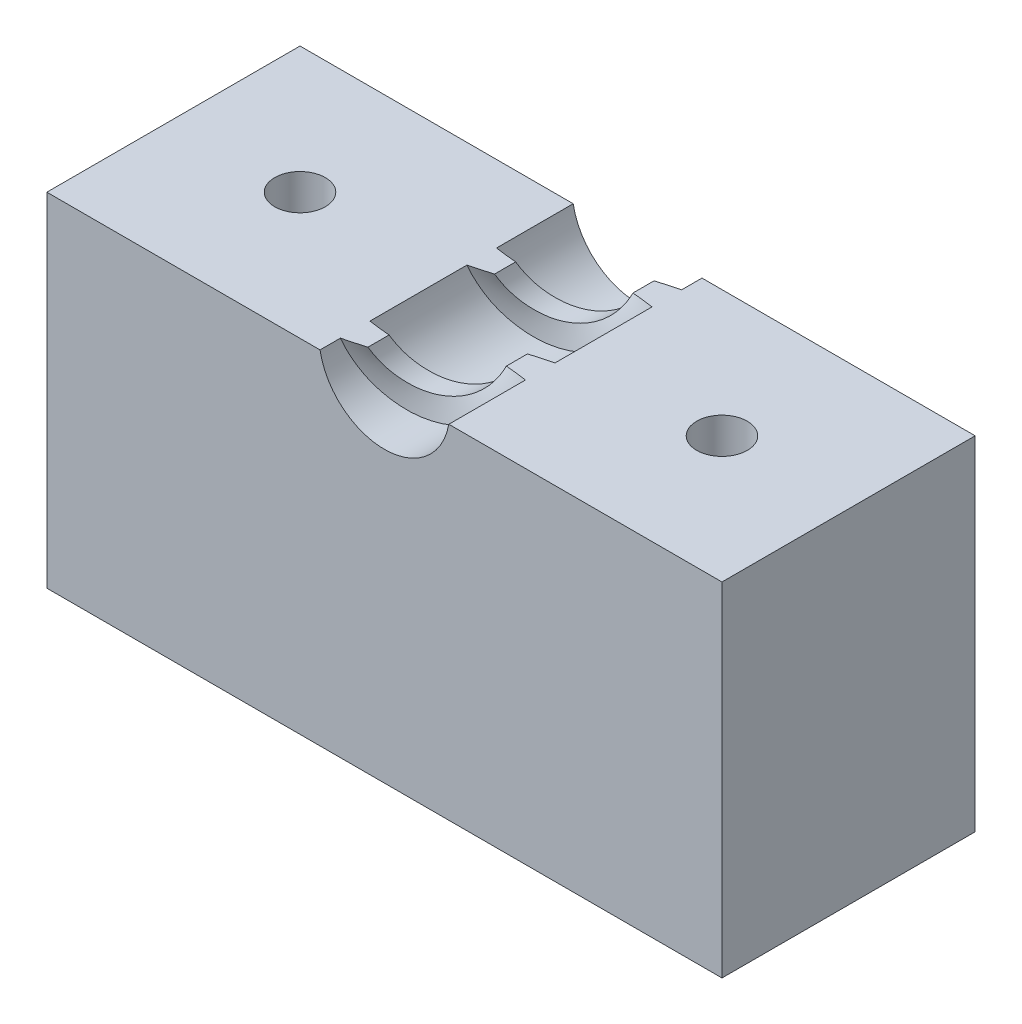
from build123d import *
from build123d.topology import SkipClean

# Parameters (mm, degrees)
SKETCH_1_W               = 16
SKETCH_1_H               = 16
SKETCH_1_R               = 1.55
EXTRUDE_1_DEPTH          = 3
SWEEP_1_PITCH            = 3
CUT_EXTRUDE_2_DEPTH      = 13.033723282
CUT_EXTRUDE_2_DEPTH_BACK = 13.033723282
SKETCH_8_R               = 0.6
CUT_EXTRUDE_3_DEPTH      = 12.704700005
SKETCH_11_W              = 16
SKETCH_11_H              = 6
SKETCH_11_R              = 0.6
EXTRUDE_2_DEPTH          = 0.4


with BuildPart() as part:
    # 草图1 → 凸台-拉伸1 (new, symmetric)
    with BuildSketch(Plane.XY):
        Rectangle(SKETCH_1_W, SKETCH_1_H)
        Circle(SKETCH_1_R, mode=Mode.SUBTRACT)
    extrude(amount=EXTRUDE_1_DEPTH, both=True)

    # 扫描1: arcs per turn and ends read off the stored shape
    # 扫描1: the profile of 草图10 profile screwed along a left-hand helix through 2 turns, 10 arcs to a turn; built about Z, then put on its axis
    sweep_1_z = Axis((0, 0, 0), (0, 0, 1))
    sweep_1_corners = [(1.5503, 0, -0.39994), (1.5503, 0, -1.10006), (1.05, 0, -1), (1.05, 0, -0.5)]
    with BuildLine(mode=Mode.PRIVATE) as sweep_1_profile:
        Line(sweep_1_corners[0], sweep_1_corners[1])
        Line(sweep_1_corners[1], sweep_1_corners[2])
        Line(sweep_1_corners[2], sweep_1_corners[3])
        Line(sweep_1_corners[3], sweep_1_corners[0])
    sweep_1_cap = Face(sweep_1_profile.wire())
    sweep_1_turn_angles = [0, -18, -36, -54, -72, -90, -108, -126, -144, -162, -180, -198, -216, -234, -252, -270, -288, -306, -324, -342, -360]
    sweep_1_turn_weights = [1, 0.9510565162951535, 1, 0.9510565162951535, 1, 0.9510565162951535, 1, 0.9510565162951535, 1, 0.9510565162951535, 1, 0.9510565162951535, 1, 0.9510565162951535, 1, 0.9510565162951535, 1, 0.9510565162951535, 1, 0.9510565162951535, 1]
    sweep_1_turn_rails = [Edge.make_bspline([Vector(p[0], p[1], 0).rotate(sweep_1_z, sweep_1_turn_angles[k]) / sweep_1_turn_weights[k] + Vector(0, 0, p[2] + -SWEEP_1_PITCH * sweep_1_turn_angles[k] / 360) for k in range(21)], [0, 0, 0, 1, 1, 2, 2, 3, 3, 4, 4, 5, 5, 6, 6, 7, 7, 8, 8, 9, 9, 10, 10, 10], 2, sweep_1_turn_weights) for p in sweep_1_corners]
    sweep_1_turn_sides = [Face.make_surface_from_curves(sweep_1_turn_rails[p[0]], sweep_1_turn_rails[p[1]]) for p in [(0, 1), (1, 2), (2, 3), (3, 0)]]
    sweep_1 = Plane(origin=(0, 0, 3), x_dir=(1, 0, 0), z_dir=(0, 0, -1)) * Solid(Shell([*[p.moved(Location((0, 0, SWEEP_1_PITCH * i))) for i in range(2) for p in sweep_1_turn_sides], sweep_1_cap, sweep_1_cap.rotate(sweep_1_z, -720).moved(Location((0, 0, -SWEEP_1_PITCH * -720 / 360)))]))
    add(sweep_1)

    # 草图7 → 切除-拉伸2 (cut, two sides: drawn at the far end of the back side and taken through both)
    with BuildSketch(Plane.XY.offset(-CUT_EXTRUDE_2_DEPTH_BACK)):
        with BuildLine():
            Line((-8, -0.271759997), (-1.014222118, -0.271759997))
            ThreePointArc((-1.014222118, -0.271759997), (-0.137052502, 1.041017104), (1.05, 0))
            ThreePointArc((1.05, 0), (1.041017104, -0.137052502), (1.014222118, -0.271759997))
            Line((1.014222118, -0.271759997), (8, -0.271759997))
            Line((8, -0.271759997), (8, 8))
            Line((8, 8), (-8, 8))
            Line((-8, 8), (-8, -0.271759997))
        make_face()
        with BuildLine():
            Line((1.014222118, -0.271759997), (0, 0))
            Line((0, 0), (-1.014222118, -0.271759997))
            ThreePointArc((-1.014222118, -0.271759997), (0, -1.05), (1.014222118, -0.271759997))
        make_face()
        with BuildLine():
            Line((-1.014222118, -0.271759997), (0, 0))
            Line((0, 0), (1.014222118, -0.271759997))
            ThreePointArc((1.014222118, -0.271759997), (1.041017104, -0.137052502), (1.05, 0))
            ThreePointArc((1.05, 0), (-0.137052502, 1.041017104), (-1.014222118, -0.271759997))
        make_face()
    extrude(amount=CUT_EXTRUDE_2_DEPTH + CUT_EXTRUDE_2_DEPTH_BACK, mode=Mode.SUBTRACT)

    # 草图8 → 切除-拉伸3 (cut, through all)
    with BuildSketch(Plane(origin=(0, 0, 0), x_dir=(1, 0, 0), z_dir=(0, 1, 0))):
        with Locations(Location((-5, 0, 0), (0, 0, 270))):
            Circle(SKETCH_8_R)
        with Locations(Location((5, 0, 0), (0, 0, 270))):
            Circle(SKETCH_8_R)
    extrude(amount=-CUT_EXTRUDE_3_DEPTH, mode=Mode.SUBTRACT)

    # 草图11 → 凸台-拉伸2 (add)
    with SkipClean():  # the faces are left unmerged after this step: merging them gives an invalid solid
        with BuildSketch(Plane.XZ.offset(8)):
            Rectangle(SKETCH_11_W, SKETCH_11_H)
            with Locations((5, 0)):
                Circle(SKETCH_11_R, mode=Mode.SUBTRACT)
            with Locations(Location((-5, 0, 0), (0, 0, 180))):
                Circle(SKETCH_11_R, mode=Mode.SUBTRACT)
        extrude(amount=EXTRUDE_2_DEPTH)


solid = part.part
